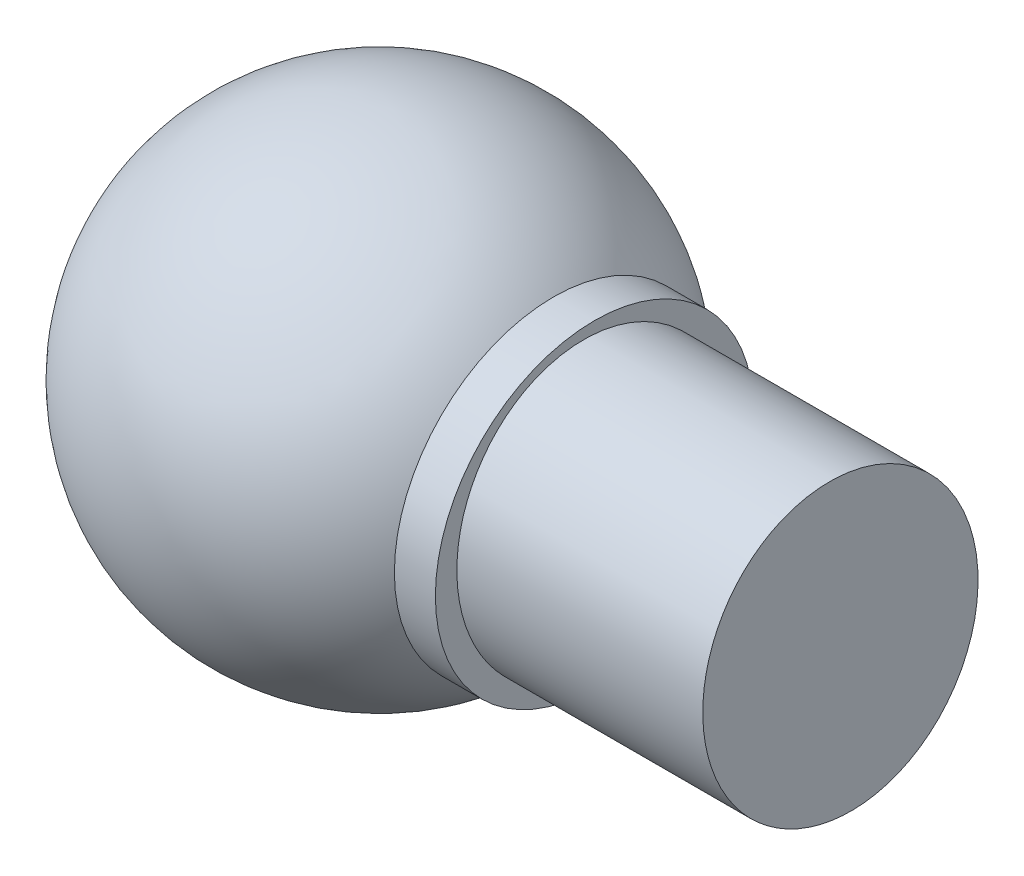
from build123d import *

# Parameters (mm, degrees)
BOSS_EXTRUDE1_DEPTH = 4
CUT_EXTRUDE3_START  = -10
CUT_EXTRUDE3_DEPTH  = 10
CUT_EXTRUDE4_DEPTH  = 10
FILLET4_START       = -1
FILLET4_DEPTH       = 6
SKETCH7_RX          = 1.83432271
SKETCH7_RY          = 1.648181576
BOSS_EXTRUDE2_DEPTH = 3
SKETCH8_R           = 1.941403724
BOSS_EXTRUDE3_DEPTH = 0.5
CUT_EXTRUDE5_DEPTH  = 5
CUT_EXTRUDE6_DEPTH  = 10


with BuildPart() as part:
    # Sketch1 → Boss-Extrude1 (new body)
    with BuildSketch(Plane(origin=(0, 0, 0), x_dir=(0, 0, -1), z_dir=(1, 0, 0))):
        with BuildLine():
            Line((6.442518848, 0), (13.409619329, 0))
            ThreePointArc((13.409619329, 0), (16.945153235, -1.464466094), (18.409619329, -5))
            Line((18.409619329, -5), (18.409619329, -20.34540211))
            ThreePointArc((18.409619329, -20.34540211), (16.945153235, -23.880936016), (13.409619329, -25.34540211))
            Line((13.409619329, -25.34540211), (6.442518848, -25.34540211))
            ThreePointArc((6.442518848, -25.34540211), (2.906984942, -23.880936016), (1.442518848, -20.34540211))
            Line((1.442518848, -20.34540211), (1.442518848, -5))
            ThreePointArc((1.442518848, -5), (2.906984942, -1.464466094), (6.442518848, 0))
        make_face()
    extrude(amount=BOSS_EXTRUDE1_DEPTH)

    # Sketch2 → Cut-Extrude3 (cut)
    with BuildSketch(Plane(origin=(4, 0, 0), x_dir=(0, 0, -1), z_dir=(1, 0, 0)).offset(CUT_EXTRUDE3_START)):
        with BuildLine():
            add(Edge.make_bspline(
                [(2.42884403, -23.286077848), (2.370716158, -22.573896831), (4.185530255, -21.12926271), (4.874517164, -17.962112227), (7.118988975, -13.802662727), (6.544049448, -7.530329658), (1.569055746, -5.349803368), (1.58046752, -3.833613753)],
                knots=[0.531334438, 0.531334438, 0.531334438, 0.531334438, 0.570400737, 0.608236932, 0.680812242, 0.778589658, 0.857107486, 0.857107486, 0.857107486, 0.857107486], degree=3))
            ThreePointArc((1.58046752, -3.833613753), (1.47712578, -4.412742239), (1.442518848, -5))
            Line((1.442518848, -5), (1.442518848, -20.34540211))
            ThreePointArc((1.442518848, -20.34540211), (1.683757797, -21.87974016), (2.384196149, -23.266021372))
            add(Edge.make_bspline(
                [(2.384196149, -23.266021372), (2.399070873, -23.272759012), (2.413953527, -23.279444568), (2.428844038, -23.286077844)],
                knots=[0.998981394, 0.998981394, 0.998981394, 0.998981394, 0.999513034, 0.999513034, 0.999513034, 0.999513034], degree=3))
        make_face()
        with BuildLine():
            Line((13.409619329, 0), (9.46398266, 0))
            add(Edge.make_bspline(
                [(9.46398266, 0), (11.207503001, -0.168664697), (14.40943711, -0.885845558), (18.093070912, -5.600973008), (14.034927819, -11.50687924), (8.23474836, -15.211494887), (7.662204752, -25.591568315), (4.542739971, -24.937885151)],
                knots=[0, 0, 0, 0, 0.077946221, 0.143334379, 0.228662798, 0.345497184, 0.490655992, 0.490655992, 0.490655992, 0.490655992], degree=3))
            add(Edge.make_bspline(
                [(4.54273997, -24.937885153), (5.749127141, -25.532851997), (7.208451258, -25.09277451), (8.521498661, -25.334156754), (8.57622256, -25.34540211)],
                knots=[0.001400322, 0.001400322, 0.001400322, 0.001400322, 0.038459748, 0.040079073, 0.040079073, 0.040079073, 0.040079073], degree=3))
            Line((8.57622256, -25.34540211), (13.409619329, -25.34540211))
            ThreePointArc((13.409619329, -25.34540211), (16.945153235, -23.880936016), (18.409619329, -20.34540211))
            Line((18.409619329, -20.34540211), (18.409619329, -5))
            ThreePointArc((18.409619329, -5), (16.945153235, -1.464466094), (13.409619329, 0))
        make_face()
        with BuildLine():
            ThreePointArc((2.906984942, -1.464466094), (4.529101686, -0.380602337), (6.442518848, 0))
            add(Edge.make_bspline(
                [(6.442518848, 0), (7.443592251, 0.121124965), (8.454170968, 0.097687179), (9.46398266, 0)],
                knots=[0.954855127, 0.954855127, 0.954855127, 0.954855127, 1, 1, 1, 1], degree=3))
            Line((9.46398266, 0), (13.409619329, 0))
            ThreePointArc((13.409619329, 0), (16.945153235, -1.464466094), (18.409619329, -5))
            Line((18.409619329, -5), (18.409619329, -20.34540211))
            ThreePointArc((18.409619329, -20.34540211), (16.945153235, -23.880936016), (13.409619329, -25.34540211))
            Line((13.409619329, -25.34540211), (8.57622256, -25.34540211))
            add(Edge.make_bspline(
                [(8.57622256, -25.34540211), (10.509849295, -25.742748085), (21.004932545, -37.507061135), (40.108036136, 7.046689321), (11.067178354, 5.045725954), (-13.182357735, 4.105959789), (-4.736766595, -20.04051671), (2.384196149, -23.266021372)],
                knots=[0.040079073, 0.040079073, 0.040079073, 0.040079073, 0.09729665, 0.409886449, 0.593670055, 0.744469586, 0.998981394, 0.998981394, 0.998981394, 0.998981394], degree=3))
            ThreePointArc((2.384196149, -23.266021372), (1.683757797, -21.87974016), (1.442518848, -20.34540211))
            Line((1.442518848, -20.34540211), (1.442518848, -5))
            ThreePointArc((1.442518848, -5), (1.47712578, -4.412742239), (1.58046752, -3.833613753))
            add(Edge.make_bspline(
                [(1.58046752, -3.833613753), (1.586363874, -3.050213083), (2.186842654, -2.121305338), (2.906984942, -1.464466094)],
                knots=[0.857107486, 0.857107486, 0.857107486, 0.857107486, 0.897676897, 0.897676897, 0.897676897, 0.897676897], degree=3))
        make_face()
    extrude(amount=CUT_EXTRUDE3_DEPTH, mode=Mode.SUBTRACT)

    # Sketch6 → Cut-Extrude4 (cut)
    with BuildSketch(Plane(origin=(4, 0, 0), x_dir=(0, 0, -1), z_dir=(1, 0, 0))):
        with BuildLine():
            add(Edge.make_bspline(
                [(6.876629539, -24.646378986), (6.348652857, -24.697603605), (5.705170416, -25.181041107), (2.967179599, -24.643973727), (6.798679283, -26.524715176), (10.198220508, -25.437781208), (7.742791771, -24.562343399), (6.876629539, -24.646378986)],
                knots=[0, 0, 0, 0, 0.142115473, 0.262842986, 0.576183637, 0.76685513, 1, 1, 1, 1], degree=3))
        make_face()
    extrude(amount=-CUT_EXTRUDE4_DEPTH, mode=Mode.SUBTRACT)

    # Fillet4: read off the stored shape, not the designer's step
    # Fillet4 outline → Fillet4 (cut)
    with BuildSketch(Plane.YZ.offset(FILLET4_START)):
        with BuildLine():
            ThreePointArc((0, -8.890200058), (-0.027061887, -9.625390775), (-0.108101078, -10.356602363))
            add(Edge.make_bspline(
                [(0, -9.46398266), (-0.028832047, -9.762025236), (-0.064132076, -10.060000995), (-0.108101078, -10.356602363)],
                knots=[0, 0, 0, 0, 0.01332436, 0.01332436, 0.01332436, 0.01332436], degree=3))
            Line((0, -9.46398266), (0, -8.890200058))
        make_face()
    extrude(amount=FILLET4_DEPTH, mode=Mode.SUBTRACT)

    # Sketch7 → Boss-Extrude2 (add)
    with BuildSketch(Plane.ZY):
        with Locations(Location((-12.079238976, -5.176946967), (0, 0, 66.52385958))):
            Ellipse(SKETCH7_RX, SKETCH7_RY)
    extrude(amount=BOSS_EXTRUDE2_DEPTH)

    # Sketch8 → Boss-Extrude3 (add)
    with BuildSketch(Plane.ZY.offset(3)):
        with Locations((-12.079238976, -5.176946967)):
            Circle(SKETCH8_R)
    extrude(amount=BOSS_EXTRUDE3_DEPTH)

    # Dome1: read off the stored shape, not the designer's step
    # Dome1 outline → Dome1 (revolve)
    with BuildSketch(Plane(origin=(0, -5.176946967, -12.079238976), x_dir=(0, 1, 0), z_dir=(0, 0, -1))):
        with BuildLine():
            Line((0, -3.499999998), (0, -8.5))
            ThreePointArc((0, -8.5), (2.681839314, -6.664401723), (1.941403723, -3.499999999))
            Line((1.941403723, -3.499999999), (0, -3.499999998))
        make_face()
    revolve(axis=Axis((0, -5.176946967, -12.079238976), (1, 0, 0)))

    # Sketch9 → Cut-Extrude5 (cut)
    with BuildSketch(Plane.ZY):
        with BuildLine():
            Line((-4.325838527, -20.140987675), (-2.486204677, -24.505449301))
            add(Edge.make_bspline(
                [(-2.486204677, -24.505449301), (3.73593799, -24.171685926), (-2.121854058, -16.126748366), (-4.325838527, -20.140987675)],
                knots=[0, 0, 0, 0, 1, 1, 1, 1], degree=3))
        make_face()
    extrude(amount=-CUT_EXTRUDE5_DEPTH, mode=Mode.SUBTRACT)

    # Sketch10 → Cut-Extrude6 (cut)
    with BuildSketch(Plane.ZY):
        with BuildLine():
            add(Edge.make_bspline(
                [(-20.598699556, -6.394321891), (-16.755827274, 0.910133144), (9.164509457, 10.912523184), (-0.036389797, -25.461480915), (-14.467778879, -53.72221039), (-27.813040504, -20.107197366), (-20.598699556, -6.394321891)],
                knots=[0, 0, 0, 0, 0.192062033, 0.555519923, 0.639436107, 1, 1, 1, 1], degree=3))
        make_face()
    extrude(amount=-CUT_EXTRUDE6_DEPTH, mode=Mode.SUBTRACT)


solid = part.part
